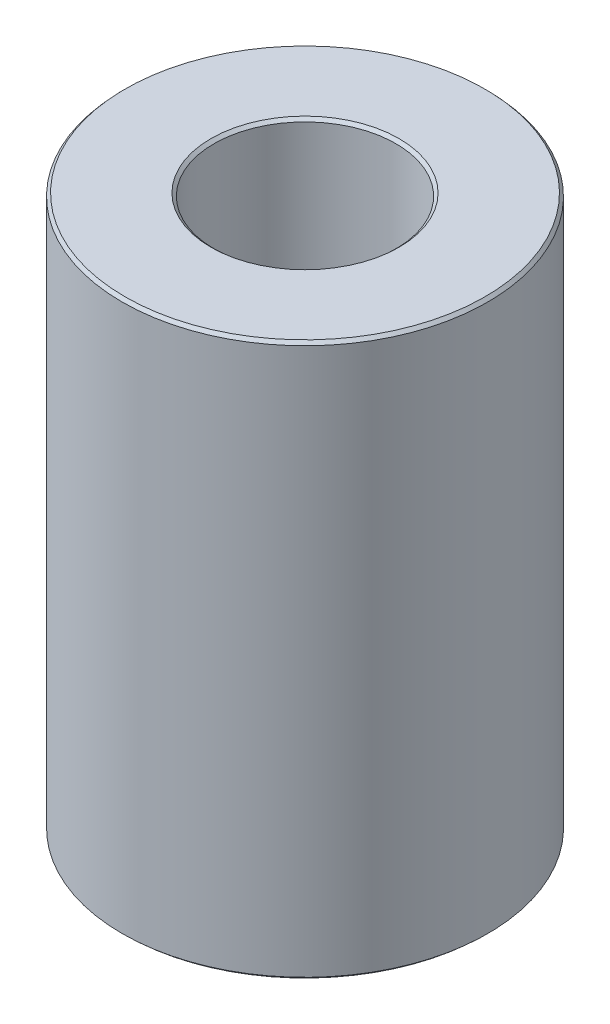
from build123d import *
from OCP.BRepFilletAPI import BRepFilletAPI_MakeChamfer

# Parameters (mm, degrees)
SKETCH1_R           = 50
BOSS_EXTRUDE1_DEPTH = 151.245814746
SKETCH2_R           = 24.891512266
CUT_EXTRUDE1_DEPTH  = 167.95896645
CHAMFER1_SIZE       = 0.854113057
CHAMFER1_SIZE2      = 0.775924782


with BuildPart() as part:
    # Sketch1 → Boss-Extrude1 (new body)
    with BuildSketch(Plane(origin=(0, 0, 0), x_dir=(1, 0, 0), z_dir=(0, 1, 0))):
        Circle(SKETCH1_R)
    extrude(amount=BOSS_EXTRUDE1_DEPTH)

    # Sketch2 → Cut-Extrude1 (cut, through all)
    with BuildSketch(Plane(origin=(0, 0, 0), x_dir=(1, 0, 0), z_dir=(0, 1, 0))):
        Circle(SKETCH2_R)
    extrude(amount=CUT_EXTRUDE1_DEPTH, mode=Mode.SUBTRACT)

    # Chamfer1: one chamfer whose edges measure the first distance from different faces: ONE call of the kernel's chamfer builder (chamfer() names one face for all edges)
    chamfer1_edges_1 = [part.edges().sort_by_distance(p)[0] for p in [
        (-24.891512266, 151.245814746, 0),
    ]]
    chamfer1_side_1 = [part.faces().sort_by_distance(p)[0] for p in [
        (-48.585786438, 151.245814746, 0),
    ]]
    chamfer1_edges_2 = [part.edges().sort_by_distance(p)[0] for p in [
        (-24.891512266, 0, 0),
    ]]
    chamfer1_side_2 = [part.faces().sort_by_distance(p)[0] for p in [
        (-24.891512266, 75.622907373, 0),
    ]]
    chamfer1_edges_3 = [part.edges().sort_by_distance(p)[0] for p in [
        (-50, 0, 0),
    ]]
    chamfer1_side_3 = [part.faces().sort_by_distance(p)[0] for p in [
        (-48.585786438, 0, 0),
    ]]
    chamfer1_edges_4 = [part.edges().sort_by_distance(p)[0] for p in [
        (-50, 151.245814746, 0),
    ]]
    chamfer1_side_4 = [part.faces().sort_by_distance(p)[0] for p in [
        (-50, 75.622907373, 0),
    ]]
    chamfer1 = BRepFilletAPI_MakeChamfer(part.part.solid().wrapped)
    for e in chamfer1_edges_1:
        chamfer1.Add(CHAMFER1_SIZE, CHAMFER1_SIZE2, e.wrapped, chamfer1_side_1[0].wrapped)  # the first distance lies on this face
    for e in chamfer1_edges_2:
        chamfer1.Add(CHAMFER1_SIZE, CHAMFER1_SIZE2, e.wrapped, chamfer1_side_2[0].wrapped)  # the first distance lies on this face
    for e in chamfer1_edges_3:
        chamfer1.Add(CHAMFER1_SIZE, CHAMFER1_SIZE2, e.wrapped, chamfer1_side_3[0].wrapped)  # the first distance lies on this face
    for e in chamfer1_edges_4:
        chamfer1.Add(CHAMFER1_SIZE, CHAMFER1_SIZE2, e.wrapped, chamfer1_side_4[0].wrapped)  # the first distance lies on this face
    add(Compound.cast(chamfer1.Shape()), mode=Mode.REPLACE)


solid = part.part
